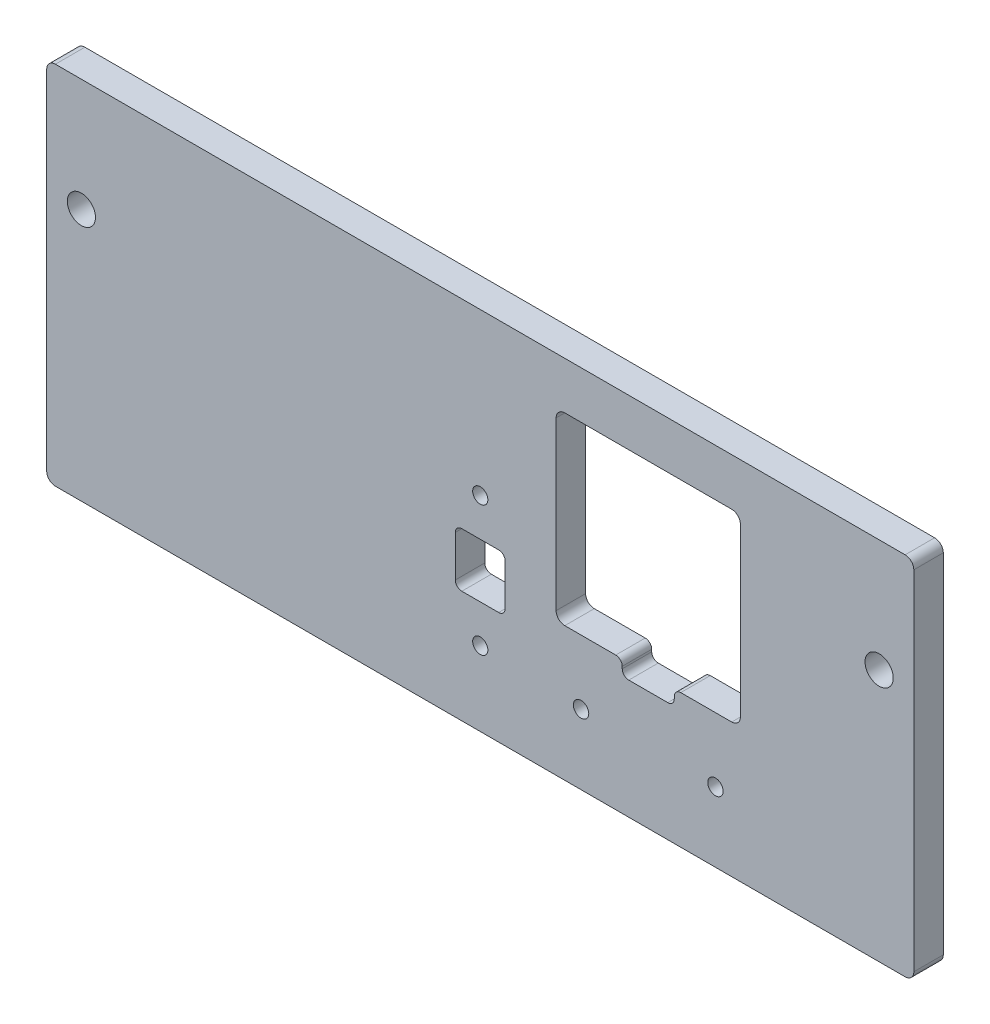
from build123d import *

# Parameters (mm, degrees)
SKETCH1_W           = 200
SKETCH1_H           = 84.3
BOSS_EXTRUDE1_DEPTH = 6.8
SKETCH2_R           = 3.25
CUT_EXTRUDE1_DEPTH  = 6.8
FILLET1_R           = 2
SKETCH3_R           = 1.775
SKETCH3_W           = 42.5
SKETCH3_H           = 42.5
CUT_EXTRUDE2_DEPTH  = 109.732987175
FILLET2_R           = 2
SKETCH4_W           = 12
SKETCH4_H           = 7
CUT_EXTRUDE3_DEPTH  = 109.732987175
FILLET3_R           = 1.5
SKETCH5_R           = 1.75
SKETCH5_W           = 11.5
SKETCH5_H           = 12.5
CUT_EXTRUDE4_DEPTH  = 109.732987175
FILLET4_R           = 1.5


with BuildPart() as part:
    # Sketch1 → Boss-Extrude1 (new body)
    with BuildSketch(Plane.XY):
        Rectangle(SKETCH1_W, SKETCH1_H)
    extrude(amount=BOSS_EXTRUDE1_DEPTH)

    # Sketch2 → Cut-Extrude1 (cut)
    with BuildSketch(Plane.XY.offset(6.8)):
        with Locations((-92, 16.15)):
            Circle(SKETCH2_R)
        with Locations((92, 16.15)):
            Circle(SKETCH2_R)
    extrude(amount=-CUT_EXTRUDE1_DEPTH, mode=Mode.SUBTRACT)

    # Fillet1
    fillet1_edges = [part.edges().sort_by_distance(p)[0] for p in [
        (100, 42.15, 3.4),
        (100, -42.15, 3.4),
        (-100, -42.15, 3.4),
        (-100, 42.15, 3.4),
    ]]
    fillet(fillet1_edges, radius=FILLET1_R)

    # Sketch3 → Cut-Extrude2 (cut, through all)
    with BuildSketch(Plane.XY.offset(6.8)):
        with Locations((23.25, -26.082)):
            Circle(SKETCH3_R)
        with Locations((54.25, -26.082)):
            Circle(SKETCH3_R)
        with Locations((38.75, 10)):
            Rectangle(SKETCH3_W, SKETCH3_H)
    extrude(amount=-CUT_EXTRUDE2_DEPTH, mode=Mode.SUBTRACT)

    # Fillet2
    fillet2_edges = [part.edges().sort_by_distance(p)[0] for p in [
        (60, 31.25, 3.4),
        (17.5, 31.25, 3.4),
        (17.5, -11.25, 3.4),
        (60, -11.25, 3.4),
    ]]
    fillet(fillet2_edges, radius=FILLET2_R)

    # Sketch4 → Cut-Extrude3 (cut, through all)
    with BuildSketch(Plane.XY.offset(6.8)):
        with Locations((38.75, -11.25)):
            Rectangle(SKETCH4_W, SKETCH4_H)
    extrude(amount=-CUT_EXTRUDE3_DEPTH, mode=Mode.SUBTRACT)

    # Fillet3
    fillet3_edges = [part.edges().sort_by_distance(p)[0] for p in [
        (44.75, -14.75, 3.4),
        (32.75, -14.75, 3.4),
        (32.75, -11.25, 3.4),
        (44.75, -11.25, 3.4),
    ]]
    fillet(fillet3_edges, radius=FILLET3_R)

    # Sketch5 → Cut-Extrude4 (cut, through all)
    with BuildSketch(Plane.XY.offset(6.8)):
        with Locations((0, -25)):
            Circle(SKETCH5_R)
        with Locations((0, 5)):
            Circle(SKETCH5_R)
        with Locations((0, -10)):
            Rectangle(SKETCH5_W, SKETCH5_H)
    extrude(amount=-CUT_EXTRUDE4_DEPTH, mode=Mode.SUBTRACT)

    # Fillet4
    fillet4_edges = [part.edges().sort_by_distance(p)[0] for p in [
        (-5.75, -3.75, 3.4),
        (5.75, -3.75, 3.4),
        (5.75, -16.25, 3.4),
        (-5.75, -16.25, 3.4),
    ]]
    fillet(fillet4_edges, radius=FILLET4_R)


solid = part.part
